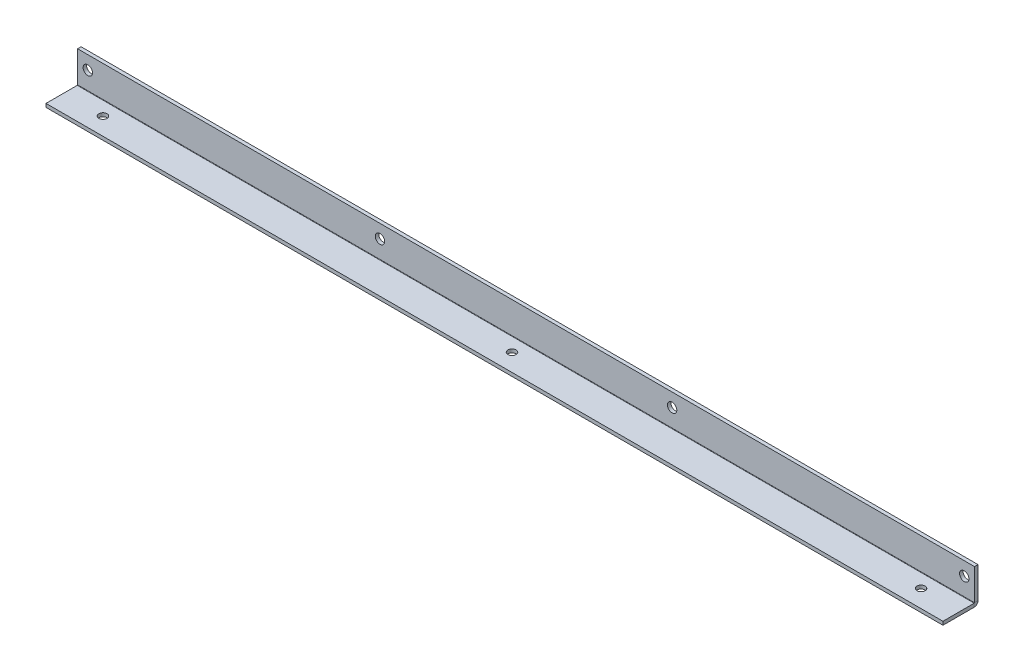
from build123d import *

# Parameters (mm, degrees)
SKETCH1_W                    = 389.89
SKETCH1_H                    = 15.24
BASE_FLANGE1_DEPTH           = 1.524
EDGE_FLANGE1_STRIP_W         = 6.4008
EDGE_FLANGE1_STRIP_H         = 1.524
EDGE_FLANGE1_STRIP_CUT_DEPTH = 389.89
EDGE_FLANGE1_DEPTH           = 389.89
SKETCH9_R                    = 2.032
CUT_EXTRUDE1_DEPTH           = 2.54
SKETCH10_R                   = 1.778
CUT_EXTRUDE2_DEPTH           = 2.54


# Sheet-metal steps are written as plain solids
with BuildPart() as part:
    # Sketch1 → Base-Flange1 (new body)
    with BuildSketch(Plane.XY):
        with Locations((194.945, 7.62)):
            Rectangle(SKETCH1_W, SKETCH1_H)
    extrude(amount=-BASE_FLANGE1_DEPTH)

    # Edge-Flange1 strip (across the edge) → Edge-Flange1 strip cut (cut)
    with BuildSketch(Plane.YZ):
        with Locations((-1.524, -0.762)):
            Rectangle(EDGE_FLANGE1_STRIP_W, EDGE_FLANGE1_STRIP_H)
    extrude(amount=EDGE_FLANGE1_STRIP_CUT_DEPTH, mode=Mode.SUBTRACT)

    # Edge-Flange1 section (across the edge) → Edge-Flange1 (add)
    with BuildSketch(Plane.YZ):
        with BuildLine():
            Line((0, 0.1524), (0, 13.716))
            Line((0, 13.716), (1.524, 13.716))
            Line((1.524, 13.716), (1.524, 0.1524))
            ThreePointArc((1.524, 0.1524), (1.568636927, 0.044636927), (1.6764, 0))
            Line((1.6764, 0), (1.6764, -1.524))
            ThreePointArc((1.6764, -1.524), (0.491006192, -1.032993808), (0, 0.1524))
        make_face()
    extrude(amount=EDGE_FLANGE1_DEPTH)

    # Sketch9 → Cut-Extrude1 (cut)
    with BuildSketch(Plane.XY):
        with Locations((4.445, 9.398)):
            Circle(SKETCH9_R)
        with Locations((131.445, 9.398)):
            Circle(SKETCH9_R)
        with Locations((258.445, 9.398)):
            Circle(SKETCH9_R)
        with Locations((385.445, 9.398)):
            Circle(SKETCH9_R)
    extrude(amount=-CUT_EXTRUDE1_DEPTH, mode=Mode.SUBTRACT)

    # Sketch10 → Cut-Extrude2 (cut)
    with BuildSketch(Plane(origin=(0, 1.524, 0), x_dir=(1, 0, 0), z_dir=(0, 1, 0))):
        with Locations(Location((372.745, -6.096, 0), (0, 0, 270))):
            Circle(SKETCH10_R)
        with Locations(Location((194.945, -6.096, 0), (0, 0, 270))):
            Circle(SKETCH10_R)
        with Locations(Location((17.145, -6.096, 0), (0, 0, 270))):
            Circle(SKETCH10_R)
    extrude(amount=-CUT_EXTRUDE2_DEPTH, mode=Mode.SUBTRACT)


solid = part.part
